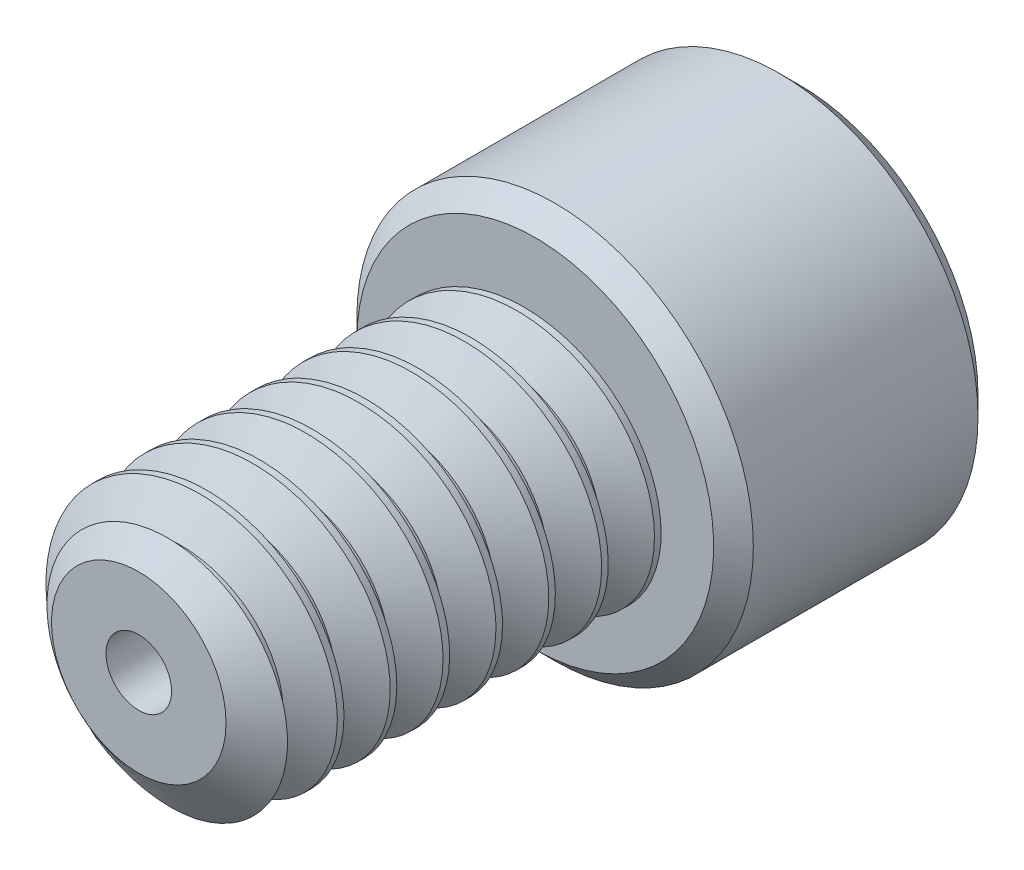
from build123d import *

# Parameters (mm, degrees)
SKETCH1_R          = 3.175
EXTRUDE1_DEPTH     = 9.525
CUT_SWEEP1_PITCH   = 1.27
SKETCH6_R          = 4.7625
EXTRUDE2_DEPTH     = 6.35
CUT_EXTRUDE1_DEPTH = 3.571875
CHAMFER1_SIZE      = 0.47625
SKETCH11_R         = 0.7874
CUT_EXTRUDE3_DEPTH = 18.24466403


with BuildPart() as part:
    # Sketch1 → Extrude1 (new body)
    with BuildSketch(Plane.XY):
        Circle(SKETCH1_R)
    extrude(amount=-EXTRUDE1_DEPTH)

    # Cut-Sweep1: the profile of Sketch3 profile screwed along a right-hand helix of 8.5 turns, 6 arcs to a turn; built about Z, then put on its axis
    cut_sweep1_z = Axis((0, 0, 0), (0, 0, 1))
    cut_sweep1_corners = [(3.1753, 0, -1.111423205), (2.350110803, 0, -0.635), (2.350110803, 0, -0.47625), (3.1753, 0, 0.000173205)]
    with BuildLine(mode=Mode.PRIVATE) as cut_sweep1_profile:
        Line(cut_sweep1_corners[0], cut_sweep1_corners[1])
        Line(cut_sweep1_corners[1], cut_sweep1_corners[2])
        Line(cut_sweep1_corners[2], cut_sweep1_corners[3])
        Line(cut_sweep1_corners[3], cut_sweep1_corners[0])
    cut_sweep1_cap = Face(cut_sweep1_profile.wire())
    cut_sweep1_turn_angles = [0, 30, 60, 90, 120, 150, 180, 210, 240, 270, 300, 330, 360]
    cut_sweep1_turn_weights = [1, 0.8660254037844387, 1, 0.8660254037844387, 1, 0.8660254037844387, 1, 0.8660254037844387, 1, 0.8660254037844387, 1, 0.8660254037844387, 1]
    cut_sweep1_turn_rails = [Edge.make_bspline([Vector(p[0], p[1], 0).rotate(cut_sweep1_z, cut_sweep1_turn_angles[k]) / cut_sweep1_turn_weights[k] + Vector(0, 0, p[2] + CUT_SWEEP1_PITCH * cut_sweep1_turn_angles[k] / 360) for k in range(13)], [0, 0, 0, 1, 1, 2, 2, 3, 3, 4, 4, 5, 5, 6, 6, 6], 2, cut_sweep1_turn_weights) for p in cut_sweep1_corners]
    cut_sweep1_turn_sides = [Face.make_surface_from_curves(cut_sweep1_turn_rails[p[0]], cut_sweep1_turn_rails[p[1]]) for p in [(0, 1), (1, 2), (2, 3), (3, 0)]]
    cut_sweep1_last_angles = [2880, 2910, 2940, 2970, 3000, 3030, 3060]
    cut_sweep1_last_weights = [1, 0.8660254037844387, 1, 0.8660254037844387, 1, 0.8660254037844466, 1]
    cut_sweep1_last_rails = [Edge.make_bspline([Vector(p[0], p[1], 0).rotate(cut_sweep1_z, cut_sweep1_last_angles[k]) / cut_sweep1_last_weights[k] + Vector(0, 0, p[2] + CUT_SWEEP1_PITCH * cut_sweep1_last_angles[k] / 360) for k in range(7)], [0, 0, 0, 1, 1, 2, 2, 3, 3, 3], 2, cut_sweep1_last_weights) for p in cut_sweep1_corners]
    cut_sweep1_last_sides = [Face.make_surface_from_curves(cut_sweep1_last_rails[p[0]], cut_sweep1_last_rails[p[1]]) for p in [(0, 1), (1, 2), (2, 3), (3, 0)]]
    cut_sweep1 = Plane(origin=(0, 0, 0), x_dir=(0, 1, 0), z_dir=(0, 0, -1)) * Solid(Shell([*[p.moved(Location((0, 0, CUT_SWEEP1_PITCH * i))) for i in range(8) for p in cut_sweep1_turn_sides], *cut_sweep1_last_sides, cut_sweep1_cap, cut_sweep1_cap.rotate(cut_sweep1_z, 3060).moved(Location((0, 0, CUT_SWEEP1_PITCH * 3060 / 360)))]))
    add(cut_sweep1, mode=Mode.SUBTRACT)

    # Sketch4 → Cut-Revolve1 (revolve, cut)
    with BuildSketch(Plane(origin=(0, 0, 0), x_dir=(0, 0, -1), z_dir=(1, 0, 0)), mode=Mode.PRIVATE) as cut_revolve1_sk:
        Polygon((0.755446349, 3.175), (0, 2.096110803), (0, 3.175), align=None)
    revolve(cut_revolve1_sk.sketch.rotate(Axis((0, 0, 0), (0, 0, -1)), 229.892048011), axis=Axis((0, 0, 0), (0, 0, -1)), mode=Mode.SUBTRACT)

    # Sketch6 → Extrude2 (add)
    with BuildSketch(Plane(origin=(0, 0, -9.525), x_dir=(-1, 0, 0), z_dir=(0, 0, -1))):
        Circle(SKETCH6_R)
    extrude(amount=EXTRUDE2_DEPTH)

    # Sketch7 → Cut-Extrude1 (cut)
    with BuildSketch(Plane(origin=(0, 0, -15.875), x_dir=(-1, 0, 0), z_dir=(0, 0, -1))):
        Polygon((0, 2.749630657), (-2.38125, 1.374815329), (-2.38125, -1.374815329), (0, -2.749630657), (2.38125, -1.374815329), (2.38125, 1.374815329), align=None)
    extrude(amount=-CUT_EXTRUDE1_DEPTH, mode=Mode.SUBTRACT)

    # Cut-Extrude2 cone 1 section (through the dimple's axis) → Cut-Extrude2 (revolve, cut)
    with BuildSketch(Plane(origin=(0, 0, -15.875), x_dir=(0, 1, 0), z_dir=(1, 0, 0))):
        Polygon((0, 0), (2.749630657, 0), (0, 2.749630657), align=None)
    revolve(axis=Axis((0, 0, -15.875), (0, 0, 1)), mode=Mode.SUBTRACT)

    # Chamfer1
    chamfer1_edges = [part.edges().sort_by_distance(p)[0] for p in [
        (4.7625, 0, -9.525),
        (4.7625, 0, -15.875),
    ]]
    chamfer(chamfer1_edges, length=CHAMFER1_SIZE)

    # Sketch11 → Cut-Extrude3 (cut, through all)
    with BuildSketch(Plane.XY):
        Circle(SKETCH11_R)
    extrude(amount=-CUT_EXTRUDE3_DEPTH, mode=Mode.SUBTRACT)


solid = part.part
